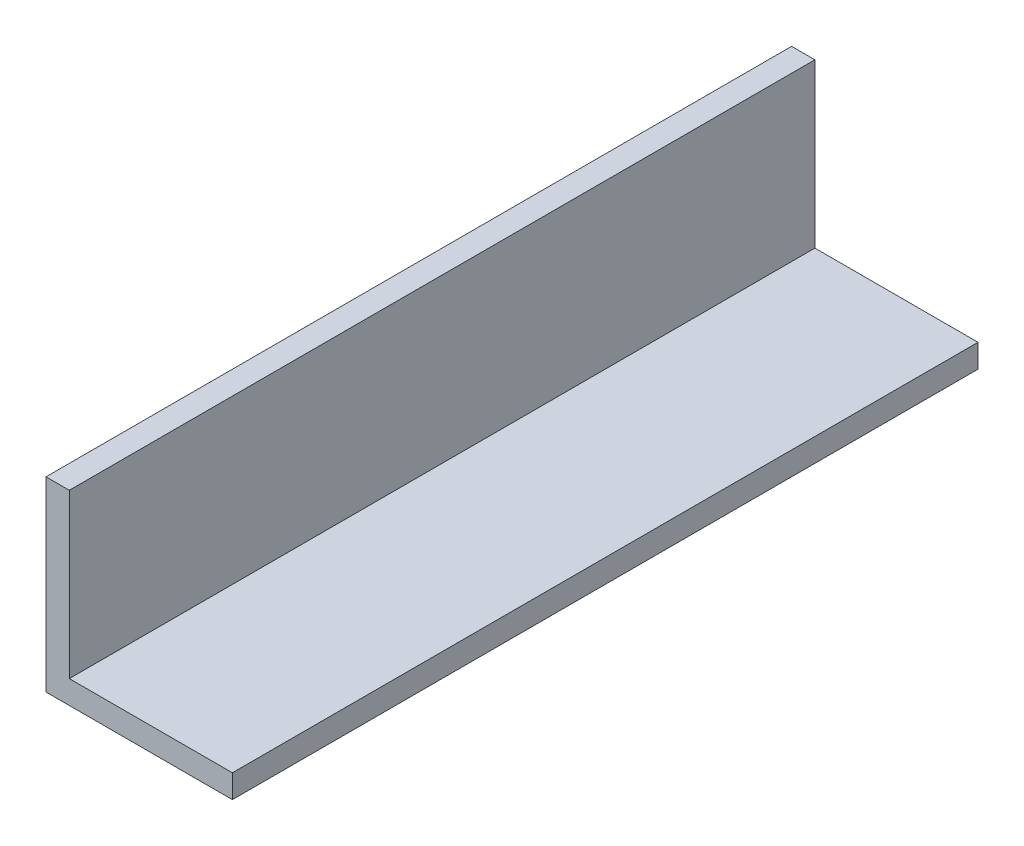
from build123d import *

# Parameters (mm, degrees)
BOSS_EXTRUDE1_DEPTH = 50.8


with BuildPart() as part:
    # Sketch1 → Boss-Extrude1 (new, symmetric)
    with BuildSketch(Plane.XY):
        Polygon((0, 25.4), (0, 0), (25.4, 0), (25.4, 3.175), (3.175, 3.175), (3.175, 25.4), align=None)
    extrude(amount=BOSS_EXTRUDE1_DEPTH, both=True)


solid = part.part
